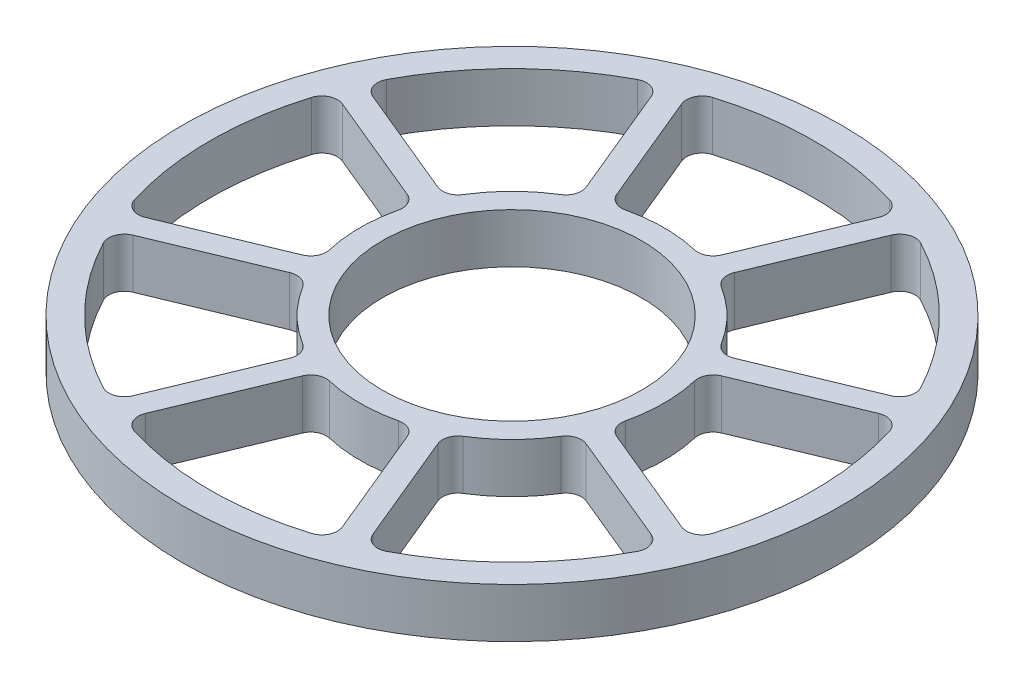
from build123d import *

# Parameters (mm, degrees)
SKETCH2_W                = 82.55
SKETCH2_H                = 12.7
CUT_EXTRUDE1_DEPTH       = 118.432086757
FILLET1_R                = 4
CIRPATTERN4_COUNT        = 8
FILLET1_OF_CIRPATTERN4_R = 4
SKETCH9_R                = 33.25
CUT_EXTRUDE2_DEPTH       = 118.432086757
BOSS_EXTRUDE1_START      = 12.7
SKETCH10_R               = 84.55
SKETCH10_R_2             = 82.55
BOSS_EXTRUDE1_DEPTH      = 12.7


with BuildPart() as part:
    # Sketch2 → Revolve1 (revolve)
    with BuildSketch(Plane(origin=(0, 0, 0), x_dir=(0, 0, -1), z_dir=(1, 0, 0))):
        with Locations((-41.275, 6.35)):
            Rectangle(SKETCH2_W, SKETCH2_H)
    revolve(axis=Axis((0, -0.5, 0), (0, 1, 0)))

    # Sketch8 → Cut-Extrude1 (cut, through all)
    with BuildSketch(Plane(origin=(0, 12.7, 0), x_dir=(1, 0, 0), z_dir=(0, 1, 0))):
        with BuildLine():
            Line((-12.108793971, 37.072592418), (-26.883247266, 72.74127794))
            ThreePointArc((-26.883247266, 72.74127794), (0, 77.55), (26.883247266, 72.74127794))
            Line((26.883247266, 72.74127794), (12.108793971, 37.072592418))
            ThreePointArc((12.108793971, 37.072592418), (0, 39), (-12.108793971, 37.072592418))
        make_face()
    cut_extrude1 = extrude(amount=-CUT_EXTRUDE1_DEPTH, mode=Mode.SUBTRACT)

    # Fillet1
    fillet1_edges = [part.edges().sort_by_distance(p)[0] for p in [
        (12.108793971, 6.35, -37.072592418),
        (26.883247266, 6.35, -72.74127794),
        (-12.108793971, 6.35, -37.072592418),
        (-26.883247266, 6.35, -72.74127794),
    ]]
    fillet(fillet1_edges, radius=FILLET1_R)

    # CirPattern4: Cut-Extrude1 ×8 about axis
    cirpattern4_axis = Axis((0, -0.5, 0), (0, 1, 0))
    for i in range(1, CIRPATTERN4_COUNT):
        add(cut_extrude1.rotate(cirpattern4_axis, i * 360 / CIRPATTERN4_COUNT), mode=Mode.SUBTRACT)

    # Fillet1 of CirPattern4
    fillet1_of_cirpattern4_edges = [part.edges().sort_by_distance(p)[0] for p in [
        (-17.652071166, 6.35, -34.776491824),
        (-32.426524461, 6.35, -70.445177346),
        (-34.776491824, 6.35, -17.652071166),
        (-70.445177346, 6.35, -32.426524461),
        (-37.072592418, 6.35, -12.108793971),
        (-72.74127794, 6.35, -26.883247266),
        (-37.072592418, 6.35, 12.108793971),
        (-72.74127794, 6.35, 26.883247266),
        (-34.776491824, 6.35, 17.652071166),
        (-70.445177346, 6.35, 32.426524461),
        (-17.652071166, 6.35, 34.776491824),
        (-32.426524461, 6.35, 70.445177346),
        (-12.108793971, 6.35, 37.072592418),
        (-26.883247266, 6.35, 72.74127794),
        (12.108793971, 6.35, 37.072592418),
        (26.883247266, 6.35, 72.74127794),
        (17.652071166, 6.35, 34.776491824),
        (32.426524461, 6.35, 70.445177346),
        (34.776491824, 6.35, 17.652071166),
        (70.445177346, 6.35, 32.426524461),
        (37.072592418, 6.35, 12.108793971),
        (72.74127794, 6.35, 26.883247266),
        (37.072592418, 6.35, -12.108793971),
        (72.74127794, 6.35, -26.883247266),
        (34.776491824, 6.35, -17.652071166),
        (70.445177346, 6.35, -32.426524461),
        (17.652071166, 6.35, -34.776491824),
        (32.426524461, 6.35, -70.445177346),
    ]]
    fillet(fillet1_of_cirpattern4_edges, radius=FILLET1_OF_CIRPATTERN4_R)

    # Sketch9 → Cut-Extrude2 (cut, through all)
    with BuildSketch(Plane(origin=(0, 12.7, 0), x_dir=(1, 0, 0), z_dir=(0, 1, 0))):
        Circle(SKETCH9_R)
    extrude(amount=-CUT_EXTRUDE2_DEPTH, mode=Mode.SUBTRACT)

    # Sketch10 → Boss-Extrude1 (add)
    with BuildSketch(Plane(origin=(0, 0, 0), x_dir=(1, 0, 0), z_dir=(0, 1, 0)).offset(BOSS_EXTRUDE1_START)):
        Circle(SKETCH10_R)
        Circle(SKETCH10_R_2, mode=Mode.SUBTRACT)
    extrude(amount=-BOSS_EXTRUDE1_DEPTH)


solid = part.part
